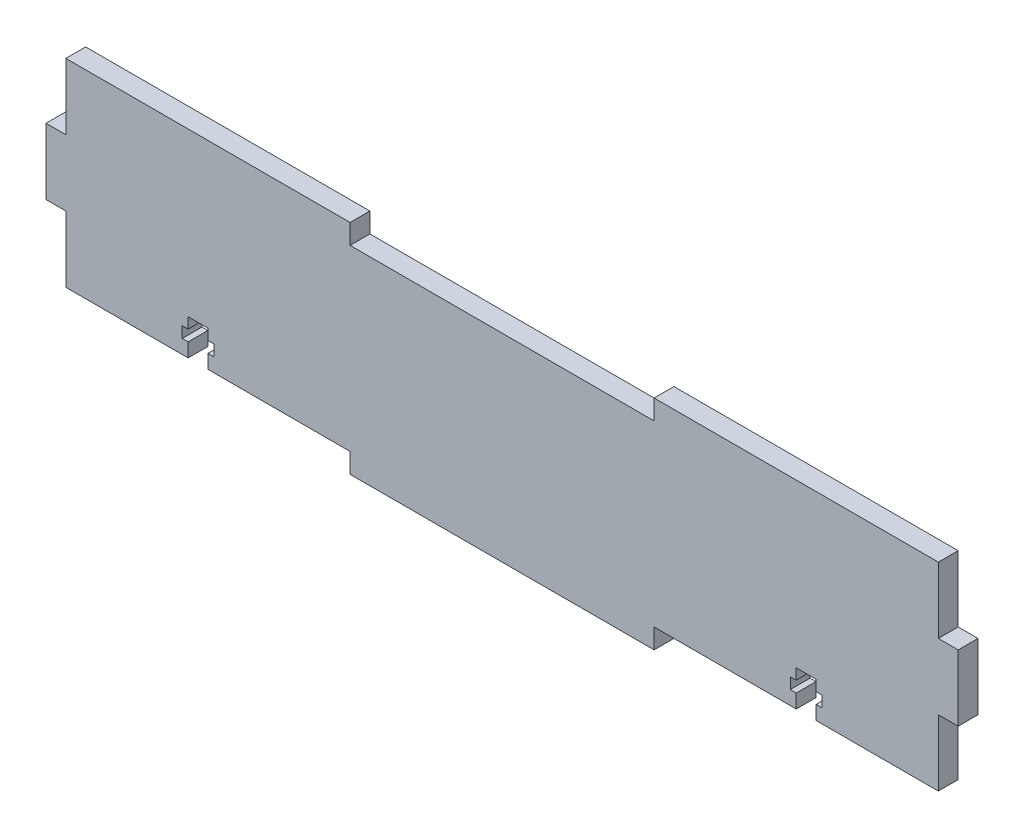
from build123d import *

# Parameters (mm, degrees)
SALIENTE_EXTRUIR1_DEPTH = 5
CORTAR_EXTRUIR1_DEPTH   = 5
CROQUIS3_W              = 76.666666666
CROQUIS3_H              = 5
CORTAR_EXTRUIR2_DEPTH   = 10


with BuildPart() as part:
    # Croquis1 → Saliente-Extruir1 (new body)
    with BuildSketch(Plane.XY):
        Polygon((76.666666667, 0), (153.333333333, 0), (153.333333333, 5), (225, 5), (225, 21.666666667), (230, 21.666666667), (230, 38.333333333), (225, 38.333333333), (225, 55), (5, 55), (5, 38.333333333), (0, 38.333333333), (0, 21.666666667), (5, 21.666666667), (5, 5), (76.666666667, 5), align=None)
    extrude(amount=SALIENTE_EXTRUIR1_DEPTH)

    # Croquis2 → Cortar-Extruir1 (cut)
    with BuildSketch(Plane.XY.offset(5)):
        Polygon((35.833333333, 5), (35.833333333, 8.5), (34.333333333, 8.5), (34.333333333, 11.3), (35.833333333, 11.3), (35.833333333, 14), (40.833333333, 14), (40.833333333, 11.3), (42.333333333, 11.3), (42.333333333, 8.5), (40.833333333, 8.5), (40.833333333, 5), align=None)
        Polygon((189.166666667, 5), (189.166666667, 8.5), (187.666666667, 8.5), (187.666666667, 11.3), (189.166666667, 11.3), (189.166666667, 14), (194.166666667, 14), (194.166666667, 11.3), (195.666666667, 11.3), (195.666666667, 8.5), (194.166666667, 8.5), (194.166666667, 5), align=None)
    extrude(amount=-CORTAR_EXTRUIR1_DEPTH, mode=Mode.SUBTRACT)

    # Croquis3 → Cortar-Extruir2 (cut)
    with BuildSketch(Plane.XY.offset(5)):
        with Locations((115, 52.5)):
            Rectangle(CROQUIS3_W, CROQUIS3_H)
    extrude(amount=-CORTAR_EXTRUIR2_DEPTH, mode=Mode.SUBTRACT)


solid = part.part
